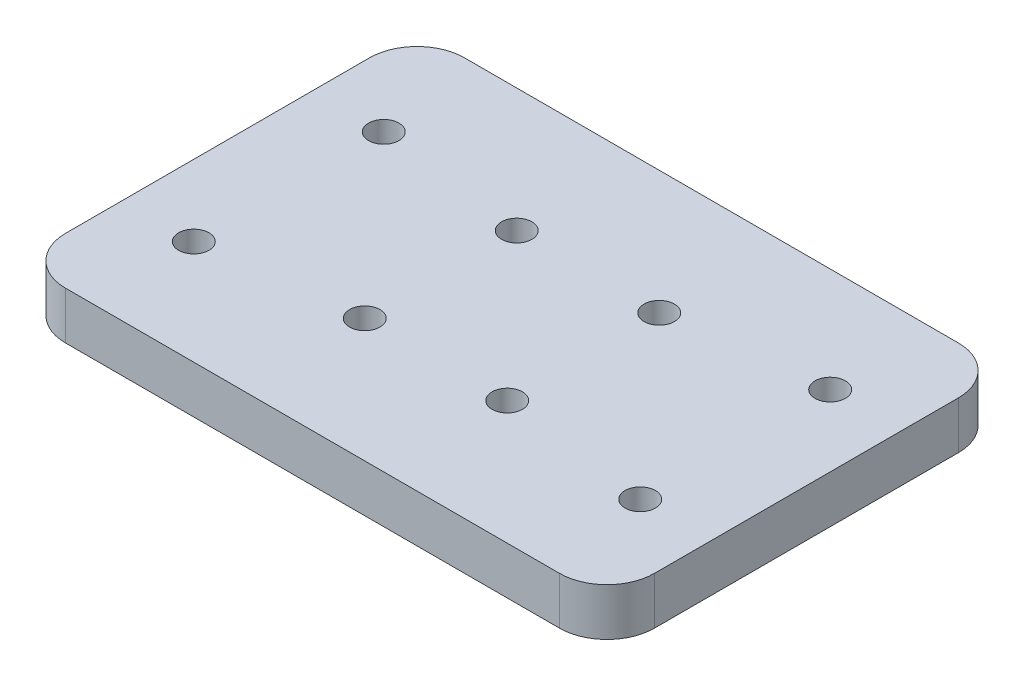
from build123d import *

# Parameters (mm, degrees)
SKETCH1_W           = 62
SKETCH1_H           = 42
SKETCH1_R           = 1.6
BOSS_EXTRUDE1_DEPTH = 5
SKETCH2_R           = 1.6
CUT_EXTRUDE1_DEPTH  = 76.053314384
FILLET1_R           = 5


with BuildPart() as part:
    # Sketch1 → Boss-Extrude1 (new body)
    with BuildSketch(Plane(origin=(0, 0, 0), x_dir=(1, 0, 0), z_dir=(0, 1, 0))):
        with Locations((31, 21)):
            Rectangle(SKETCH1_W, SKETCH1_H)
        with Locations((7.5, 31)):
            Circle(SKETCH1_R, mode=Mode.SUBTRACT)
        with Locations((7.5, 11)):
            Circle(SKETCH1_R, mode=Mode.SUBTRACT)
        with Locations((54.5, 11)):
            Circle(SKETCH1_R, mode=Mode.SUBTRACT)
        with Locations((54.5, 31)):
            Circle(SKETCH1_R, mode=Mode.SUBTRACT)
    extrude(amount=BOSS_EXTRUDE1_DEPTH)

    # Sketch2 → Cut-Extrude1 (cut, through all)
    with BuildSketch(Plane(origin=(0, 5, 0), x_dir=(1, 0, 0), z_dir=(0, 1, 0))):
        with Locations((38.5, 29)):
            Circle(SKETCH2_R)
        with Locations((38.5, 13)):
            Circle(SKETCH2_R)
        with Locations((23.5, 13)):
            Circle(SKETCH2_R)
        with Locations((23.5, 29)):
            Circle(SKETCH2_R)
    extrude(amount=-CUT_EXTRUDE1_DEPTH, mode=Mode.SUBTRACT)

    # Fillet1
    fillet1_edges = [part.edges().sort_by_distance(p)[0] for p in [
        (0, 2.5, -42),
        (62, 2.5, -42),
        (62, 2.5, 0),
        (0, 2.5, 0),
    ]]
    fillet(fillet1_edges, radius=FILLET1_R)


solid = part.part
